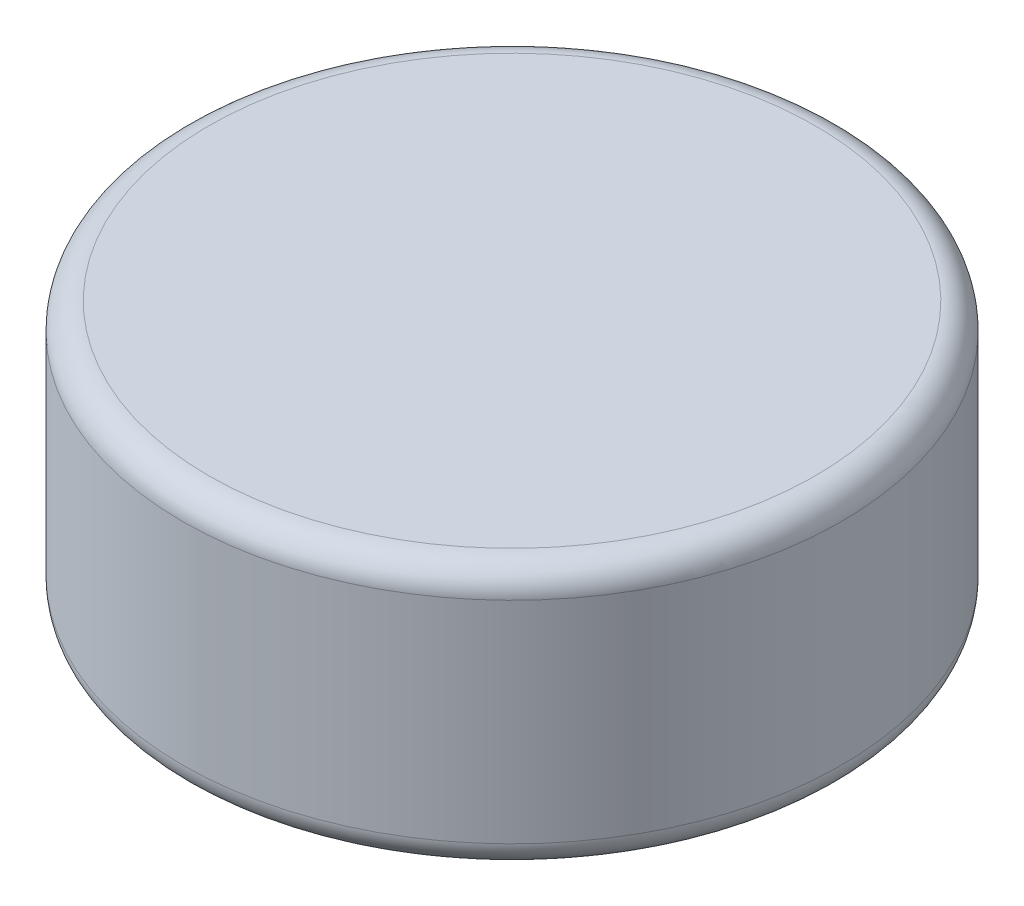
from build123d import *

# Parameters (mm, degrees)
SKETCH1_R           = 2.5
BOSS_EXTRUDE1_DEPTH = 1
FILLET1_R           = 0.2


with BuildPart() as part:
    # Sketch1 → Boss-Extrude1 (new, symmetric)
    with BuildSketch(Plane(origin=(0, 0, 0), x_dir=(1, 0, 0), z_dir=(0, 1, 0))):
        Circle(SKETCH1_R)
    extrude(amount=BOSS_EXTRUDE1_DEPTH, both=True)

    # Fillet1
    fillet1_edges = [part.edges().sort_by_distance(p)[0] for p in [
        (-2.5, -1, 0),
        (-2.5, 1, 0),
    ]]
    fillet(fillet1_edges, radius=FILLET1_R)


solid = part.part
